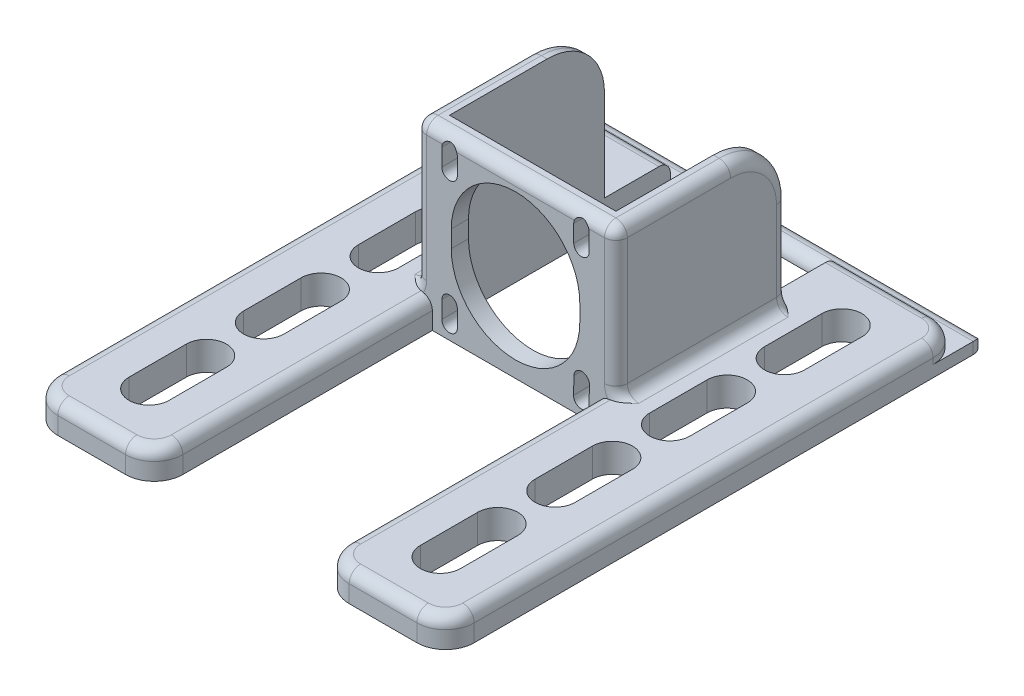
from build123d import *

# Parameters (mm, degrees)
BOSS_EXTRUDE1_DEPTH  = 3
SKETCH8_W            = 80
SKETCH8_H            = 5
BOSS_EXTRUDE3_DEPTH  = 21.8
CUT_EXTRUDE1_DEPTH   = 5
SKETCH13_W           = 21.8
SKETCH13_H           = 5
BOSS_EXTRUDE6_DEPTH  = 10
CUT_EXTRUDE2_DEPTH   = 5
SKETCH12_W           = 3
SKETCH12_H           = 26
BOSS_EXTRUDE5_DEPTH  = 30
FILLET6_R            = 5
FILLET7_R            = 2
FILLET9_R            = 10
FILLET10_R           = 2
FILLET11_R           = 2
BOSS_EXTRUDE10_DEPTH = 2
FILLET13_R           = 2


# Some blends are built 0.0001 mm under size
with BuildPart() as part:
    # Sketch6 → Boss-Extrude1 (new body)
    with BuildSketch(Plane.XY):
        Polygon((14.5, 14.5), (14.5, -14.5), (14.5, -15.5), (-14.5, -15.5), (-14.5, -14.5), (-14.5, 14.5), (-14.5, 15.5), (14.5, 15.5), align=None)
        with BuildLine():
            Line((-10.15, -10), (-10.15, -13))
            ThreePointArc((-10.15, -13), (-11.5, -14.35), (-12.85, -13))
            Line((-12.85, -13), (-12.85, -10))
            ThreePointArc((-12.85, -10), (-11.5, -8.65), (-10.15, -10))
        make_face(mode=Mode.SUBTRACT)
        with BuildLine():
            Line((10.188247074, -9.966440656), (10.11261118, -12.96548704))
            ThreePointArc((10.11261118, -12.96548704), (11.428145901, -14.349094065), (12.811752926, -13.033559344))
            Line((12.811752926, -13.033559344), (12.88738882, -10.03451296))
            ThreePointArc((12.88738882, -10.03451296), (11.571854099, -8.650905935), (10.188247074, -9.966440656))
        make_face(mode=Mode.SUBTRACT)
        with BuildLine():
            Line((-10.15, 10), (-10.15, 13))
            ThreePointArc((-10.15, 13), (-11.5, 14.35), (-12.85, 13))
            Line((-12.85, 13), (-12.85, 10))
            ThreePointArc((-12.85, 10), (-11.5, 8.65), (-10.15, 10))
        make_face(mode=Mode.SUBTRACT)
        with BuildLine():
            Line((10.15, 10), (10.15, 13))
            ThreePointArc((10.15, 13), (11.5, 14.35), (12.85, 13))
            Line((12.85, 13), (12.85, 10))
            ThreePointArc((12.85, 10), (11.5, 8.65), (10.15, 10))
        make_face(mode=Mode.SUBTRACT)
        with BuildLine():
            Line((-11.2, -1.5), (-11.2, 1.5))
            ThreePointArc((-11.2, 1.5), (0, 12.7), (11.2, 1.5))
            Line((11.2, 1.5), (11.2, -1.5))
            ThreePointArc((11.2, -1.5), (0, -12.7), (-11.2, -1.5))
        make_face(mode=Mode.SUBTRACT)
    extrude(amount=BOSS_EXTRUDE1_DEPTH)

    # Sketch8 → Boss-Extrude3 (add)
    with BuildSketch(Plane(origin=(14.5, 0, 0), x_dir=(0, 0, -1), z_dir=(1, 0, 0))):
        with Locations((-1.5, -13)):
            Rectangle(SKETCH8_W, SKETCH8_H)
    boss_extrude3 = extrude(amount=BOSS_EXTRUDE3_DEPTH)

    # Sketch9 → Cut-Extrude1 (cut)
    with BuildSketch(Plane(origin=(0, -10.5, 0), x_dir=(1, 0, 0), z_dir=(0, 1, 0))):
        with BuildLine():
            Line((21.9, 28.5), (21.9, 18.5))
            ThreePointArc((21.9, 18.5), (25.4, 15), (28.9, 18.5))
            Line((28.9, 18.5), (28.9, 28.5))
            ThreePointArc((28.9, 28.5), (25.4, 32), (21.9, 28.5))
        make_face()
        with BuildLine():
            Line((28.9, -11.5), (28.9, -21.5))
            ThreePointArc((28.9, -21.5), (25.4, -25), (21.9, -21.5))
            Line((21.9, -21.5), (21.9, -11.5))
            ThreePointArc((21.9, -11.5), (25.4, -8), (28.9, -11.5))
        make_face()
        with BuildLine():
            Line((21.9, 8.5), (21.9, -1.5))
            ThreePointArc((21.9, -1.5), (25.4, -5), (28.9, -1.5))
            Line((28.9, -1.5), (28.9, 8.5))
            ThreePointArc((28.9, 8.5), (25.4, 12), (21.9, 8.5))
        make_face()
    cut_extrude1 = extrude(amount=-CUT_EXTRUDE1_DEPTH, mode=Mode.SUBTRACT)

    # Sketch13 → Boss-Extrude6 (add)
    with BuildSketch(Plane.XY.offset(41.5)):
        with Locations((25.4, -13)):
            Rectangle(SKETCH13_W, SKETCH13_H)
    boss_extrude6 = extrude(amount=BOSS_EXTRUDE6_DEPTH)

    # Sketch14 → Cut-Extrude2 (cut)
    with BuildSketch(Plane(origin=(0, -10.5, 0), x_dir=(1, 0, 0), z_dir=(0, 1, 0))):
        with BuildLine():
            Line((21.9, -31.5), (21.9, -41.5))
            ThreePointArc((21.9, -41.5), (25.4, -45), (28.9, -41.5))
            Line((28.9, -41.5), (28.9, -31.5))
            ThreePointArc((28.9, -31.5), (25.4, -28), (21.9, -31.5))
        make_face()
    cut_extrude2 = extrude(amount=-CUT_EXTRUDE2_DEPTH, mode=Mode.SUBTRACT)

    # Mirror1: Boss-Extrude3, Cut-Extrude1, Boss-Extrude6, Cut-Extrude2 across plane
    add(boss_extrude3.mirror(Plane(origin=(0, 0, 0), x_dir=(0, 0, 1), z_dir=(1, 0, 0))))
    add(cut_extrude1.mirror(Plane(origin=(0, 0, 0), x_dir=(0, 0, 1), z_dir=(1, 0, 0))), mode=Mode.SUBTRACT)
    add(boss_extrude6.mirror(Plane(origin=(0, 0, 0), x_dir=(0, 0, 1), z_dir=(1, 0, 0))))
    add(cut_extrude2.mirror(Plane(origin=(0, 0, 0), x_dir=(0, 0, 1), z_dir=(1, 0, 0))), mode=Mode.SUBTRACT)

    # Sketch12 → Boss-Extrude5 (add)
    with BuildSketch(Plane.XY.offset(3)):
        with Locations((16, 2.5)):
            Rectangle(SKETCH12_W, SKETCH12_H)
        with Locations((-16, 2.5)):
            Rectangle(SKETCH12_W, SKETCH12_H)
    extrude(amount=-BOSS_EXTRUDE5_DEPTH)

    # Fillet6
    fillet6_edges = [part.edges().sort_by_distance(p)[0] for p in [
        (36.3, -13, 51.5),
        (14.5, -13, 51.5),
        (-36.3, -13, -38.5),
        (-36.3, -13, 51.5),
        (-14.5, -13, 51.5),
        (36.3, -13, -38.5),
    ]]
    fillet(fillet6_edges, radius=FILLET6_R)

    # Fillet7
    fillet7_edges = [part.edges().sort_by_distance(p)[0] for p in [
        (17.5, -10.5, -12),
        (-17.5, -10.5, -12),
    ]]
    fillet(fillet7_edges, radius=FILLET7_R)

    # Fillet9
    fillet9_edges = [part.edges().sort_by_distance(p)[0] for p in [
        (16, 15.5, -27),
        (-16, 15.5, -27),
    ]]
    fillet(fillet9_edges, radius=FILLET9_R)

    # Fillet10
    # the kernel refuses this fillet: 2 mm, written as the material it takes off along each edge
    with BuildSketch(Plane(origin=(-15.5, 13.5, 1), x_dir=(0, 1, 0), z_dir=(-1, 0, 0))) as fillet10_piece_1_section:
        Polygon((0, 0), (FILLET10_R * 1.02, 0), (FILLET10_R * 1.02, -FILLET10_R * 1.02), (0, -FILLET10_R * 1.02), align=None)
    fillet10_piece_1 = extrude(amount=FILLET10_R * 1.02, mode=Mode.PRIVATE)
    fillet10_piece_1 = fillet10_piece_1 - Plane(origin=(-15.5, 13.5, 1), x_dir=(0, -0.7071067811865475, -0.7071067811865475), z_dir=(-1, 0, 0)) * Sphere(FILLET10_R, mode=Mode.PRIVATE)
    add(fillet10_piece_1, mode=Mode.SUBTRACT)
    with BuildSketch(Plane(origin=(15.5, 13.5, 1), x_dir=(0, 0, 1), z_dir=(0, 1, 0))) as fillet10_piece_2_section:
        Polygon((0, 0), (FILLET10_R * 1.02, 0), (FILLET10_R * 1.02, FILLET10_R * 1.02), (0, FILLET10_R * 1.02), align=None)
    fillet10_piece_2 = extrude(amount=FILLET10_R * 1.02, mode=Mode.PRIVATE)
    fillet10_piece_2 = fillet10_piece_2 - Plane(origin=(15.5, 13.5, 1), x_dir=(-0.7071067811865475, 0, -0.7071067811865475), z_dir=(0, 1, 0)) * Sphere(FILLET10_R, mode=Mode.PRIVATE)
    add(fillet10_piece_2, mode=Mode.SUBTRACT)
    with BuildSketch(Plane(origin=(-17.5, -8.5, 3), x_dir=(0, 0, -1), z_dir=(0, 1, 0))) as fillet10_piece_3:
        with BuildLine():
            CenterArc((FILLET10_R, -FILLET10_R), FILLET10_R, 90, 90)
            Line((0, -FILLET10_R), (0, 0))
            Line((0, 0), (FILLET10_R, 0))
        make_face()
    extrude(amount=22, mode=Mode.SUBTRACT)
    with BuildSketch(Plane(origin=(17.5, 13.5, 3), x_dir=(-1, 0, 0), z_dir=(0, -1, 0))) as fillet10_piece_4:
        with BuildLine():
            CenterArc((FILLET10_R, FILLET10_R), FILLET10_R, 180, 90)
            Line((0, FILLET10_R), (0, 0))
            Line((0, 0), (FILLET10_R, 0))
        make_face()
    extrude(amount=22, mode=Mode.SUBTRACT)
    with BuildSketch(Plane(origin=(17.5, 5.5, -27), x_dir=(0, 0, 1), z_dir=(0, -1, 0))) as fillet10_piece_5:
        with BuildLine():
            CenterArc((FILLET10_R, FILLET10_R), FILLET10_R, 180, 90)
            Line((0, FILLET10_R), (0, 0))
            Line((0, 0), (FILLET10_R, 0))
        make_face()
    extrude(amount=14, mode=Mode.SUBTRACT)
    with BuildSketch(Plane(origin=(-19.5, -8.5, 3), x_dir=(-0.5976672776328299, 0.8017442392976466, 0), z_dir=(0.8017442392976466, 0.5976672776328299, 0))) as fillet10_piece_6_section:
        with BuildLine():
            CenterArc((2 + FILLET10_R, -FILLET10_R), FILLET10_R, 90, 90)
            Line((2, -FILLET10_R), (2, 0))
            Line((2, 0), (2 + FILLET10_R, 0))
        make_face()
    fillet10_piece_6 = revolve(axis=Axis((-19.5, -8.5, 3), (0, 0, 1)), revolution_arc=233.296989237, mode=Mode.PRIVATE)
    fillet10_piece_6 = split(fillet10_piece_6, bisect_by=Plane(origin=(-18.000121992, -10.5, 2.376743415), z_dir=(0, 1, 0)), keep=Keep.TOP, mode=Mode.PRIVATE)
    add(fillet10_piece_6, mode=Mode.SUBTRACT)
    with BuildSketch(Plane(origin=(-19.5, -8.5, -27), x_dir=(-0.5976672776328299, 0.8017442392976466, 0), z_dir=(0.8017442392976466, 0.5976672776328299, 0))) as fillet10_piece_7_section:
        with BuildLine():
            CenterArc((2 + FILLET10_R, FILLET10_R), FILLET10_R, 180, 90)
            Line((2, FILLET10_R), (2, 0))
            Line((2, 0), (2 + FILLET10_R, 0))
        make_face()
    fillet10_piece_7 = revolve(axis=Axis((-19.5, -8.5, -27), (0, 0, 1)), revolution_arc=233.296989237, mode=Mode.PRIVATE)
    fillet10_piece_7 = split(fillet10_piece_7, bisect_by=Plane(origin=(-18.000122038, -10.5, -26.3767434), z_dir=(0, 1, 0)), keep=Keep.TOP, mode=Mode.PRIVATE)
    add(fillet10_piece_7, mode=Mode.SUBTRACT)
    with BuildSketch(Plane(origin=(19.5, -8.5, 3), x_dir=(0.5976672776328299, 0.8017442392976466, 0), z_dir=(-0.8017442392976466, 0.5976672776328299, 0))) as fillet10_piece_8_section:
        with BuildLine():
            CenterArc((2 + FILLET10_R, FILLET10_R), FILLET10_R, 180, 90)
            Line((2, FILLET10_R), (2, 0))
            Line((2, 0), (2 + FILLET10_R, 0))
        make_face()
    fillet10_piece_8 = revolve(axis=Axis((19.5, -8.5, 3), (0, 0, -1)), revolution_arc=233.296989237, mode=Mode.PRIVATE)
    fillet10_piece_8 = split(fillet10_piece_8, bisect_by=Plane(origin=(18.000121984, -10.5, 2.376743412), z_dir=(0, 1, 0)), keep=Keep.TOP, mode=Mode.PRIVATE)
    add(fillet10_piece_8, mode=Mode.SUBTRACT)
    with BuildSketch(Plane(origin=(19.5, -8.5, -27), x_dir=(0.5976672776328299, 0.8017442392976466, 0), z_dir=(-0.8017442392976466, 0.5976672776328299, 0))) as fillet10_piece_9_section:
        with BuildLine():
            CenterArc((2 + FILLET10_R, -FILLET10_R), FILLET10_R, 90, 90)
            Line((2, -FILLET10_R), (2, 0))
            Line((2, 0), (2 + FILLET10_R, 0))
        make_face()
    fillet10_piece_9 = revolve(axis=Axis((19.5, -8.5, -27), (0, 0, -1)), revolution_arc=233.296989237, mode=Mode.PRIVATE)
    fillet10_piece_9 = split(fillet10_piece_9, bisect_by=Plane(origin=(18.000122199, -10.5, -26.376743352), z_dir=(0, 1, 0)), keep=Keep.TOP, mode=Mode.PRIVATE)
    add(fillet10_piece_9, mode=Mode.SUBTRACT)
    with BuildSketch(Plane(origin=(-17.5, 15.5, 1), x_dir=(1, 0, 0), z_dir=(0, 0, -1))) as fillet10_piece_10:
        with BuildLine():
            CenterArc((FILLET10_R, FILLET10_R), FILLET10_R, 180, 90)
            Line((0, FILLET10_R), (0, 0))
            Line((0, 0), (FILLET10_R, 0))
        make_face()
    extrude(amount=18, mode=Mode.SUBTRACT)
    with BuildSketch(Plane(origin=(17.5, 15.5, 1), x_dir=(-1, 0, 0), z_dir=(0, 0, -1))) as fillet10_piece_11:
        with BuildLine():
            CenterArc((FILLET10_R, -FILLET10_R), FILLET10_R, 90, 90)
            Line((0, -FILLET10_R), (0, 0))
            Line((0, 0), (FILLET10_R, 0))
        make_face()
    extrude(amount=18, mode=Mode.SUBTRACT)
    with BuildSketch(Plane(origin=(-17.5, -8.5, -27), x_dir=(1, 0, 0), z_dir=(0, 1, 0))) as fillet10_piece_12:
        with BuildLine():
            CenterArc((FILLET10_R, -FILLET10_R), FILLET10_R, 90, 90)
            Line((0, -FILLET10_R), (0, 0))
            Line((0, 0), (FILLET10_R, 0))
        make_face()
    extrude(amount=14, mode=Mode.SUBTRACT)
    with BuildSketch(Plane(origin=(-17.5, 5.5, -17), x_dir=(0, 0, -1), z_dir=(0, -1, 0))) as fillet10_piece_13:
        with BuildLine():
            CenterArc((10 - FILLET10_R, FILLET10_R), FILLET10_R, 270, 90)
            Line((10 - FILLET10_R, 0), (10, 0))
            Line((10, 0), (10, FILLET10_R))
        make_face()
    revolve(axis=Axis((-17.5, 5.5, -17), (1, 0, 0)), revolution_arc=90, mode=Mode.SUBTRACT)
    with BuildSketch(Plane(origin=(17.5, 5.5, -17), x_dir=(0, 0, -1), z_dir=(0, -1, 0))) as fillet10_piece_14:
        with BuildLine():
            CenterArc((10 - FILLET10_R, -FILLET10_R), FILLET10_R, 0, 90)
            Line((10 - FILLET10_R, 0), (10, 0))
            Line((10, 0), (10, -FILLET10_R))
        make_face()
    revolve(axis=Axis((17.5, 5.5, -17), (1, 0, 0)), revolution_arc=90, mode=Mode.SUBTRACT)
    with BuildSketch(Plane(origin=(-15.5, 15.5, 3), x_dir=(0, 0, -1), z_dir=(1, 0, 0))) as fillet10_piece_15:
        with BuildLine():
            CenterArc((FILLET10_R, -FILLET10_R), FILLET10_R, 90, 90)
            Line((0, -FILLET10_R), (0, 0))
            Line((0, 0), (FILLET10_R, 0))
        make_face()
    extrude(amount=31, mode=Mode.SUBTRACT)

    # Fillet11
    fillet11_edges = [part.edges().sort_by_distance(p)[0] for p in [
        (-14.5, -10.5, 24.75),
        (-22.9, -10.5, -38.5),
        (-36.3, -10.5, 6.5),
        (-25.4, -10.5, 51.5),
        (-15.964466094, -10.5, 50.035533906),
        (-34.835533906, -10.5, 50.035533906),
        (-34.835533906, -10.5, -37.035533906),
        (36.3, -10.5, 6.5),
        (25.4, -10.5, 51.5),
        (22.9, -10.5, -38.5),
        (34.835533906, -10.5, 50.035533906),
        (15.964466094, -10.5, 50.035533906),
        (34.835533906, -10.5, -37.035533906),
        (14.5, -10.5, 24.75),
    ]]
    fillet(fillet11_edges, radius=FILLET11_R)

    # Sketch17 → Boss-Extrude10 (add)
    with BuildSketch(Plane.XZ.offset(15.5)):
        with BuildLine():
            Line((-36.3, -33.5), (-36.3, -42.5))
            Line((-36.3, -42.5), (36.3, -42.5))
            Line((36.3, -42.5), (36.3, -33.5))
            ThreePointArc((36.3, -33.5), (34.835533906, -37.035533906), (31.3, -38.5))
            Line((31.3, -38.5), (-31.3, -38.5))
            ThreePointArc((-31.3, -38.5), (-34.835533906, -37.035533906), (-36.3, -33.5))
        make_face()
    extrude(amount=-BOSS_EXTRUDE10_DEPTH)

    # Fillet13
    fillet13_edges = [part.edges().sort_by_distance(p)[0] for p in [
        (0, -13.5, -38.5),
        (-36.3, -14.5, -42.5),
        (36.3, -14.5, -42.5),
        (0, -13.5, -42.5),
    ]]
    fillet(fillet13_edges, radius=FILLET13_R - 0.0001)  # a hair under: the kernel refuses the full size


solid = part.part
